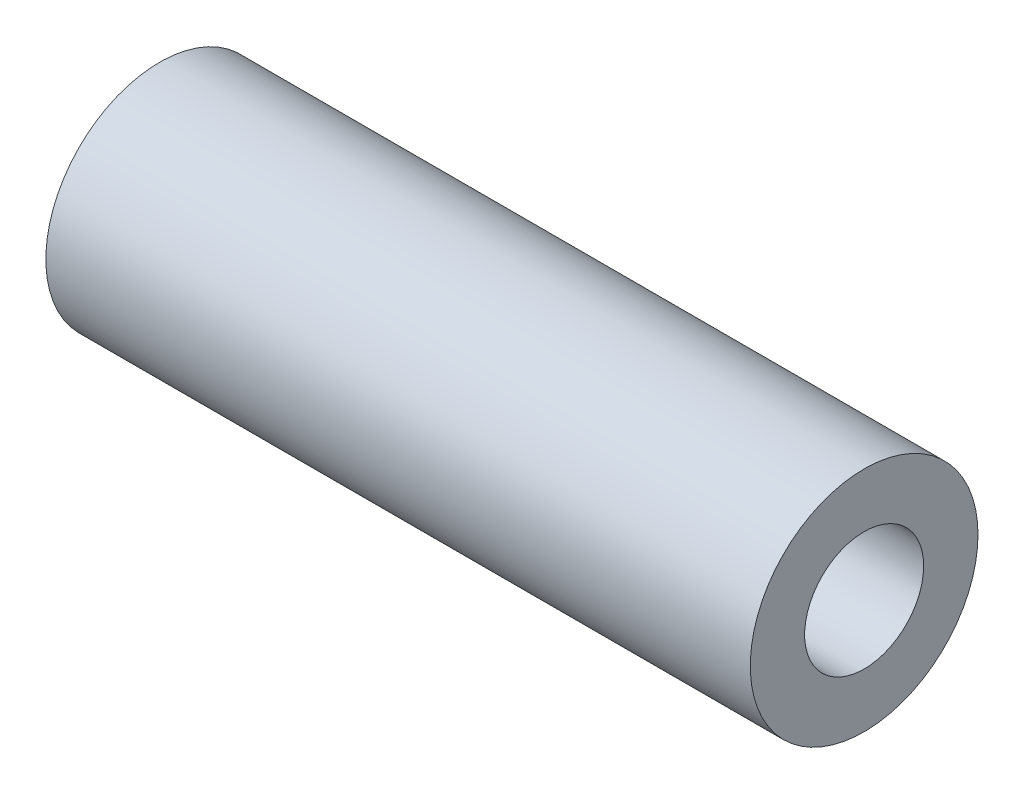
from build123d import *

# Parameters (mm, degrees)
SKETCH1_R           = 4.7625
SKETCH1_R_2         = 2.4892
BOSS_EXTRUDE1_DEPTH = 14.732


with BuildPart() as part:
    # Sketch1 → Boss-Extrude1 (new, symmetric)
    with BuildSketch(Plane(origin=(0, 0, 0), x_dir=(0, 0, -1), z_dir=(1, 0, 0))):
        Circle(SKETCH1_R)
        Circle(SKETCH1_R_2, mode=Mode.SUBTRACT)
    extrude(amount=BOSS_EXTRUDE1_DEPTH, both=True)


solid = part.part
